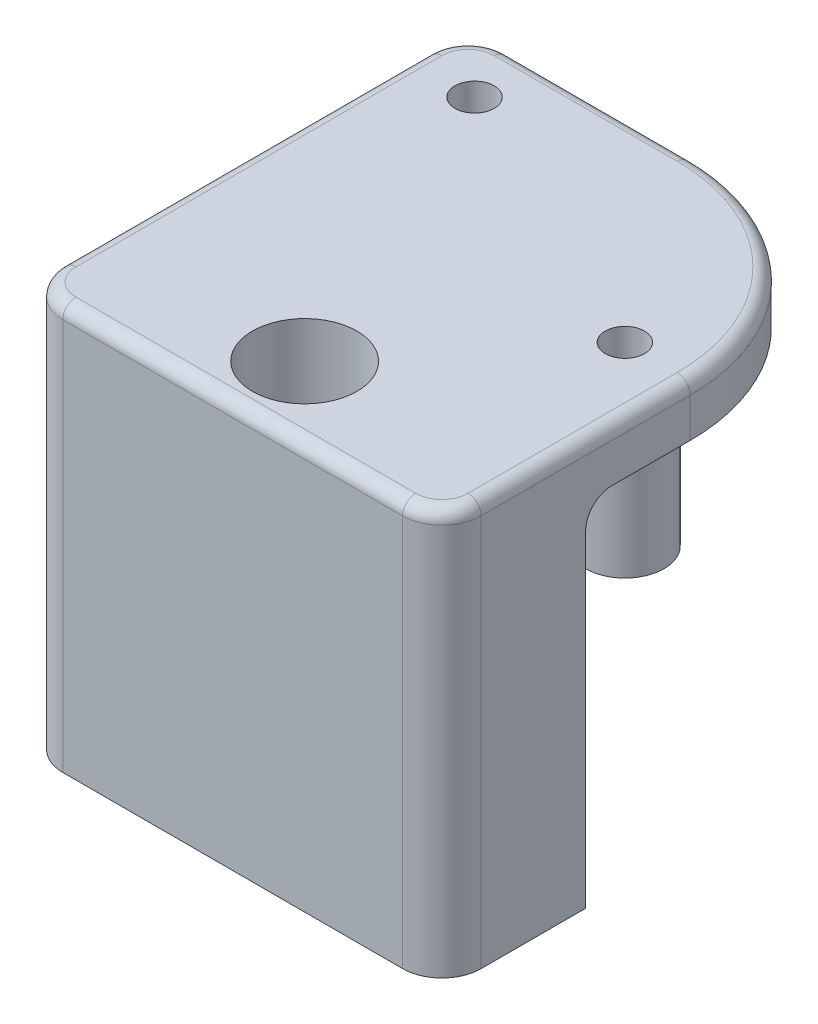
from build123d import *

# Parameters (mm, degrees)
SKETCH_1_W          = 32
SKETCH_1_H          = 11
SKETCH_1_R          = 1.6
EXTRUDE_1_DEPTH     = 27
SKETCH_2_R          = 1.5
EXTRUDE_2_DEPTH     = 4
FILLET_3_R          = 3
FILLET_4_R          = 3
CUT_EXTRUDE_START   = 10
SKETCH_3_R          = 4
CUT_EXTRUDE_1_DEPTH = 15
FILLET_5_R          = 2
EXTRUDE_START       = 9.5
SKETCH_4_R          = 3
SKETCH_4_R_2        = 1.5
EXTRUDE_3_DEPTH     = 9.5
FILLET_6_R          = 1


with BuildPart() as part:
    # Эскиз1 → Бобышка-Вытянуть1 (new body)
    with BuildSketch(Plane(origin=(0, 0, 0), x_dir=(1, 0, 0), z_dir=(0, 1, 0))):
        with Locations((16, 5.5)):
            Rectangle(SKETCH_1_W, SKETCH_1_H)
        with Locations((16, 5.5)):
            Circle(SKETCH_1_R, mode=Mode.SUBTRACT)
    extrude(amount=EXTRUDE_1_DEPTH)

    # Эскиз2 → Бобышка-Вытянуть2 (add)
    with BuildSketch(Plane(origin=(0, 27, 0), x_dir=(1, 0, 0), z_dir=(0, 1, 0))):
        with BuildLine():
            Line((32, 0), (32, 19))
            ThreePointArc((32, 19), (27.606601718, 29.606601718), (17, 34))
            Line((17, 34), (3, 34))
            ThreePointArc((3, 34), (0.878679656, 33.121320344), (0, 31))
            Line((0, 31), (0, 0))
            Line((0, 0), (32, 0))
        make_face()
        with Locations((5, 29.5)):
            Circle(SKETCH_2_R, mode=Mode.SUBTRACT)
        with Locations((27, 19)):
            Circle(SKETCH_2_R, mode=Mode.SUBTRACT)
    extrude(amount=EXTRUDE_2_DEPTH)

    # Скругление3
    fillet_3_edges = [part.edges().sort_by_distance(p)[0] for p in [
        (32, 15.5, 0),
    ]]
    fillet(fillet_3_edges, radius=FILLET_3_R)

    # Скругление4
    fillet_4_edges = [part.edges().sort_by_distance(p)[0] for p in [
        (0, 15.5, 0),
    ]]
    fillet(fillet_4_edges, radius=FILLET_4_R)

    # Эскиз3 → Вырез-Вытянуть1 (cut)
    with BuildSketch(Plane.XZ.offset(-27).offset(CUT_EXTRUDE_START)):
        with Locations((16, -5.5)):
            Circle(SKETCH_3_R)
    extrude(amount=-CUT_EXTRUDE_1_DEPTH, mode=Mode.SUBTRACT)

    # Скругление5
    fillet_5_edges = [part.edges().sort_by_distance(p)[0] for p in [
        (16, 27, -11),
    ]]
    fillet(fillet_5_edges, radius=FILLET_5_R)

    # Эскиз4 → Бобышка-Вытянуть3 (add)
    with BuildSketch(Plane.XZ.offset(-27).offset(EXTRUDE_START)):
        with Locations((27, -19)):
            Circle(SKETCH_4_R)
        with Locations((27, -19)):
            Circle(SKETCH_4_R_2, mode=Mode.SUBTRACT)
    extrude(amount=-EXTRUDE_3_DEPTH)

    # Скругление6
    fillet_6_edges = [part.edges().sort_by_distance(p)[0] for p in [
        (32, 31, -11),
        (27.606601718, 31, -29.606601718),
        (10, 31, -34),
        (0.878679656, 31, -33.121320344),
        (0, 31, -17),
        (31.121320344, 31, -0.878679656),
        (16, 31, 0),
        (0.878679656, 31, -0.878679656),
    ]]
    fillet(fillet_6_edges, radius=FILLET_6_R)


solid = part.part
